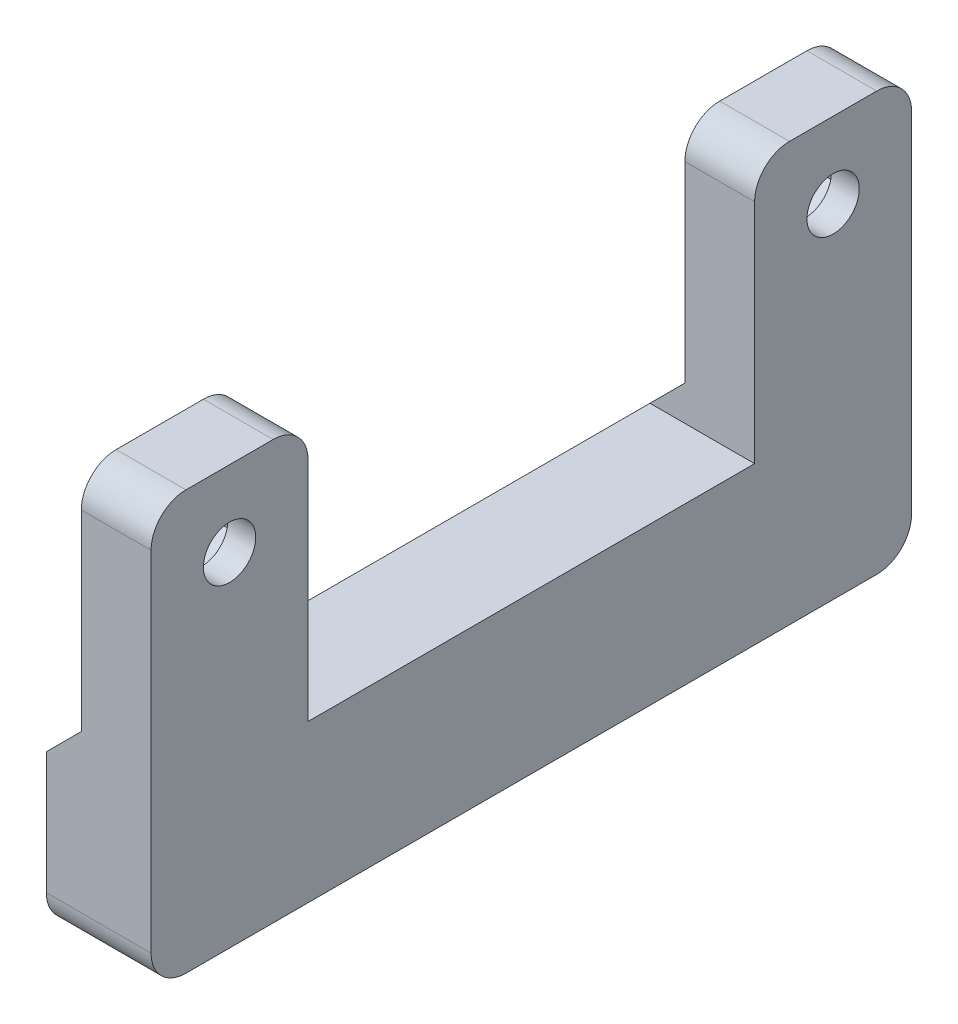
from build123d import *

# Parameters (mm, degrees)
EXTRUDE_1_DEPTH     = 4
SKETCH_2_R          = 1.5
CUT_EXTRUDE_1_DEPTH = 53.719070053
CUT_EXTRUDE_3_DEPTH = 2.4
EXTRUDE_2_DEPTH     = 2
FILLET_3_R          = 2
CHAMFER_1_SIZE      = 2


with BuildPart() as part:
    # Эскиз1 → Бобышка-Вытянуть1 (new body)
    with BuildSketch(Plane(origin=(0, 0, 0), x_dir=(0, 0, -1), z_dir=(1, 0, 0))):
        Polygon((-49.583333333, 6.541666667), (-49.583333333, -17.458333333), (-5.983333333, -17.458333333), (-5.983333333, 6.541666667), (-14.983333333, 6.541666667), (-14.983333333, -8.458333333), (-40.583333333, -8.458333333), (-40.583333333, 6.541666667), align=None)
    extrude(amount=EXTRUDE_1_DEPTH)

    # Эскиз2 → Вырез-Вытянуть1 (cut, through all)
    with BuildSketch(Plane.ZY):
        with Locations((10.483333333, 2.190961295)):
            Circle(SKETCH_2_R)
        with Locations((45.083333333, 2.190961295)):
            Circle(SKETCH_2_R)
    extrude(amount=-CUT_EXTRUDE_1_DEPTH, mode=Mode.SUBTRACT)

    # Эскиз4 → Вырез-Вытянуть3 (cut)
    with BuildSketch(Plane.ZY):
        Polygon((10.483333333, 5.337520262), (7.758333333, 3.764240779), (7.758333333, 0.617681812), (10.483333333, -0.955597672), (13.208333333, 0.617681812), (13.208333333, 3.764240779), align=None)
        Polygon((45.083333333, 5.337520262), (42.358333333, 3.764240779), (42.358333333, 0.617681812), (45.083333333, -0.955597672), (47.808333333, 0.617681812), (47.808333333, 3.764240779), align=None)
    extrude(amount=-CUT_EXTRUDE_3_DEPTH, mode=Mode.SUBTRACT)

    # Эскиз6 → Бобышка-Вытянуть2 (add)
    with BuildSketch(Plane.ZY):
        Polygon((5.983333333, -6.458333333), (14.983333333, -6.458333333), (14.983333333, -8.458333333), (40.583333333, -8.458333333), (40.583333333, -6.458333333), (49.583333333, -6.458333333), (49.583333333, -17.458333333), (5.983333333, -17.458333333), align=None)
    extrude(amount=EXTRUDE_2_DEPTH)

    # Скругление3
    fillet_3_edges = [part.edges().sort_by_distance(p)[0] for p in [
        (2, 6.541666667, 40.583333333),
        (2, 6.541666667, 14.983333333),
        (2, 6.541666667, 5.983333333),
        (1, -17.458333333, 5.983333333),
        (1, -17.458333333, 49.583333333),
        (2, 6.541666667, 49.583333333),
    ]]
    fillet(fillet_3_edges, radius=FILLET_3_R)

    # Фаска1
    chamfer_1_edges = [part.edges().sort_by_distance(p)[0] for p in [
        (-2, -6.458333333, 10.483333333),
        (-2, -6.458333333, 45.083333333),
    ]]
    chamfer(chamfer_1_edges, length=CHAMFER_1_SIZE - 0.0001)  # a hair under: the kernel refuses the full size


solid = part.part
